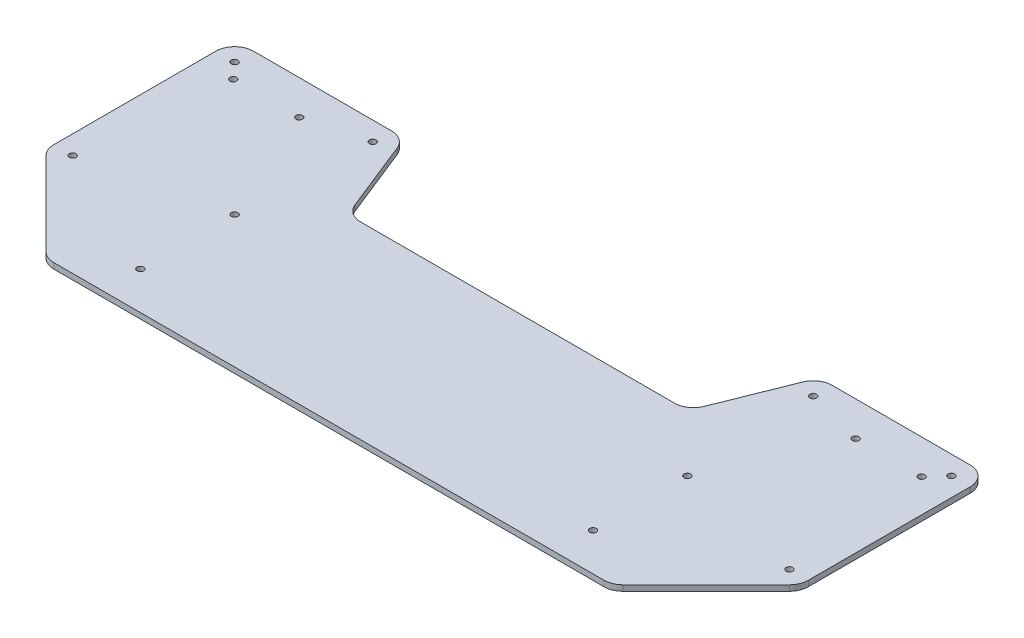
from build123d import *

# Parameters (mm, degrees)
EXTRUDE_1_DEPTH     = 3
SKETCH_2_R          = 1.75
CUT_EXTRUDE_1_DEPTH = 59
SKETCH_3_R          = 1.75
CUT_EXTRUDE_2_DEPTH = 59
SKETCH_4_R          = 1.75
CUT_EXTRUDE_3_DEPTH = 59


with BuildPart() as part:
    # 草图1 → 凸台-拉伸1 (new body)
    with BuildSketch(Plane(origin=(0, 0, 0), x_dir=(1, 0, 0), z_dir=(0, 1, 0))):
        with BuildLine():
            Line((-197.071067812, -27.928932188), (-152.928932188, -72.071067812))
            ThreePointArc((-152.928932188, -72.071067812), (-149.6846987, -74.238795325), (-145.857864376, -75))
            Line((-145.857864376, -75), (145.857864376, -75))
            ThreePointArc((145.857864376, -75), (149.6846987, -74.238795325), (152.928932188, -72.071067812))
            Line((152.928932188, -72.071067812), (197.071067812, -27.928932188))
            ThreePointArc((197.071067812, -27.928932188), (199.238795325, -24.6846987), (200, -20.857864376))
            Line((200, -20.857864376), (200, 65))
            ThreePointArc((200, 65), (197.071067812, 72.071067812), (190, 75))
            Line((190, 75), (116.770329614, 75))
            ThreePointArc((116.770329614, 75), (111.164041521, 73.280672305), (107.485562705, 68.713906764))
            Line((107.485562705, 68.713906764), (92.514437295, 31.286093236))
            ThreePointArc((92.514437295, 31.286093236), (88.835958479, 26.719327695), (83.229670386, 25))
            Line((83.229670386, 25), (-83.229670386, 25))
            ThreePointArc((-83.229670386, 25), (-88.835958479, 26.719327695), (-92.514437295, 31.286093236))
            Line((-92.514437295, 31.286093236), (-107.485562705, 68.713906764))
            ThreePointArc((-107.485562705, 68.713906764), (-111.164041521, 73.280672305), (-116.770329614, 75))
            Line((-116.770329614, 75), (-190, 75))
            ThreePointArc((-190, 75), (-197.071067812, 72.071067812), (-200, 65))
            Line((-200, 65), (-200, -20.857864376))
            ThreePointArc((-200, -20.857864376), (-199.238795325, -24.6846987), (-197.071067812, -27.928932188))
        make_face()
    extrude(amount=EXTRUDE_1_DEPTH)

    # 草图2 → 切除-拉伸1 (cut)
    with BuildSketch(Plane.XZ):
        with Locations((120, 5)):
            Circle(SKETCH_2_R)
        with Locations((120, 55)):
            Circle(SKETCH_2_R)
        with Locations((-120, 55)):
            Circle(SKETCH_2_R)
        with Locations((-120, 5)):
            Circle(SKETCH_2_R)
    extrude(amount=-CUT_EXTRUDE_1_DEPTH, mode=Mode.SUBTRACT)

    # 草图3 → 切除-拉伸2 (cut)
    with BuildSketch(Plane(origin=(0, 3, 0), x_dir=(1, 0, 0), z_dir=(0, 1, 0))):
        with Locations((116.770329614, 65)):
            Circle(SKETCH_3_R)
        with Locations((190, 65)):
            Circle(SKETCH_3_R)
        with Locations((-190, 65)):
            Circle(SKETCH_3_R)
        with Locations((-116.770329614, 65)):
            Circle(SKETCH_3_R)
        with Locations((-190, -20.857864376)):
            Circle(SKETCH_3_R)
        with Locations((190, -20.857864376)):
            Circle(SKETCH_3_R)
    extrude(amount=-CUT_EXTRUDE_2_DEPTH, mode=Mode.SUBTRACT)

    # 草图4 → 切除-拉伸3 (cut)
    with BuildSketch(Plane.XZ):
        with Locations((147.5, -56.75)):
            Circle(SKETCH_4_R)
        with Locations((182.5, -56.75)):
            Circle(SKETCH_4_R)
        with Locations((-182.5, -56.75)):
            Circle(SKETCH_4_R)
        with Locations((-147.5, -56.75)):
            Circle(SKETCH_4_R)
    extrude(amount=-CUT_EXTRUDE_3_DEPTH, mode=Mode.SUBTRACT)


solid = part.part
